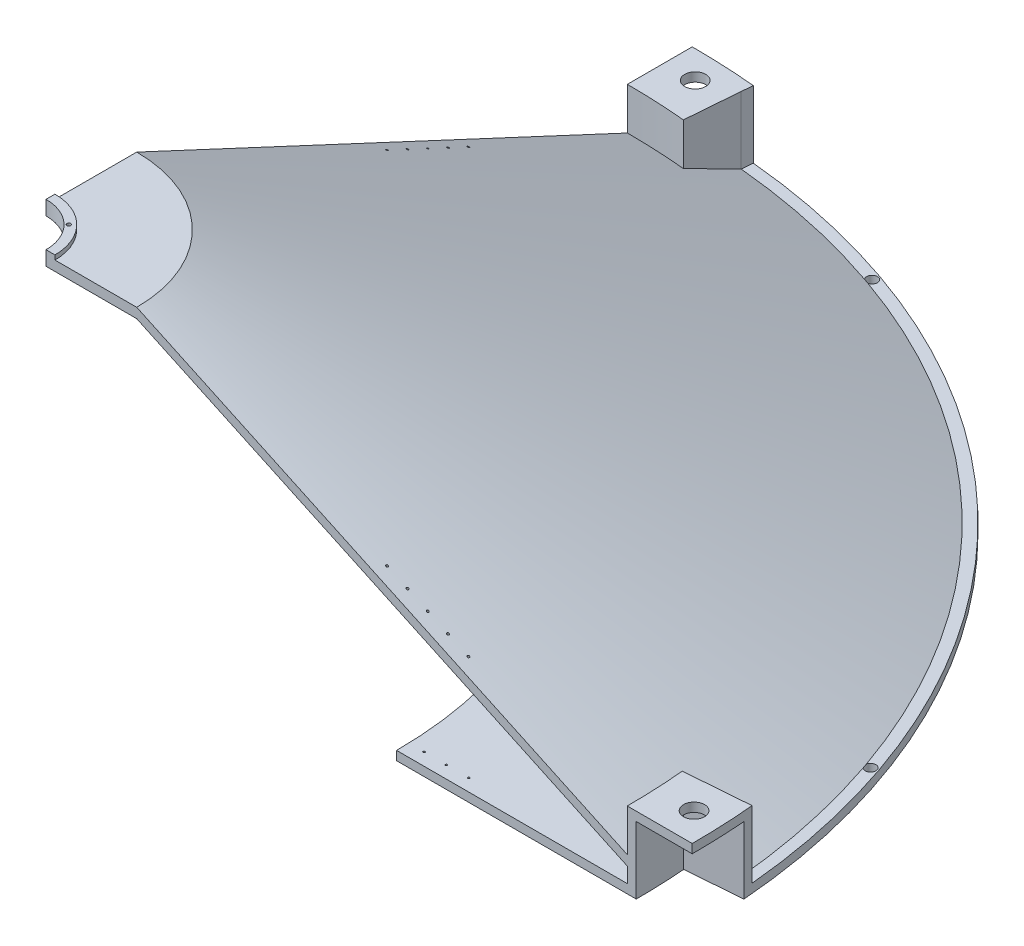
from build123d import *

# Parameters (mm, degrees)
REVOLVE_2_ANGLE            = 90
CUT_EXTRUDE_1_DEPTH        = 2251.376533994
CUT_EXTRUDE_1_DEPTH_BACK   = 2251.376533994
CUT_EXTRUDE_2_DEPTH        = 2246.838580031
EXTRUDE_START              = -20
EXTRUDE_2_DEPTH            = 20
EXTRUDE_3_DEPTH            = 130
EXTRUDE_4_DEPTH            = 130
EXTRUDE_5_DEPTH            = 20
CUT_EXTRUDE_5_DEPTH        = 2251.376534019
CUT_EXTRUDE_5_DEPTH_BACK   = 2251.376534019
EXTRUDE_6_DEPTH            = 150
EXTRUDE_7_DEPTH            = 20
EXTRUDE_START_2            = -22.067558379
EXTRUDE_8_DEPTH            = 22.067558379
EXTRUDE_9_DEPTH            = 10
EXTRUDE_10_DEPTH           = 20
EXTRUDE_11_DEPTH           = 20
CUT_EXTRUDE_12_DEPTH       = 10
HOLE_WIZARD_M5_2_D         = 4.2
HOLE_WIZARD_M5_2_DEPTH     = 20
CUT_EXTRUDE_13_REACH       = 2080.406
SKETCH_35_R                = 2.5
PATTERN_START              = 638.392822278
PATTERN_LINEAR_1_OUTLINE_R = 2.5
PATTERN_LINEAR_1_DEPTH     = 19.869622652
HOLE_WIZARD_M10_1_D        = 8.5
M52X5_0_1_D                = 47
M52X5_0_2_D                = 47
SKETCH_46_W                = 12
SKETCH_46_H                = 20
SKETCH_47_W                = 12
SKETCH_47_H                = 20


# Read off the part's stored shape, not the designer's step: 阵列(线性)1
with BuildPart() as part:
    # 草图1 → 旋转2 (revolve)
    with BuildSketch(Plane.XY):
        Polygon((1540, 0), (1540, 20), (1515, 20), (300, 586.563804658), (280, 586.563804658), (280, 564.496246279), (300, 564.496246279), (1467.675968337, 20), (1390, 20), (1390, 0), align=None)
    revolve(axis=Axis((0, 0, 0), (0, 1, 0)), revolution_arc=REVOLVE_2_ANGLE)

    # 草图2 → 切除-拉伸1 (cut, two sides: drawn at the far end of the back side and taken through both)
    with BuildSketch(Plane(origin=(0, 20, 0), x_dir=(1, 0, 0), z_dir=(0, 1, 0)).offset(-CUT_EXTRUDE_1_DEPTH_BACK)):
        with BuildLine():
            Line((132.87469752, 1408.889390534), (140.845680115, 1508.438760571))
            ThreePointArc((140.845680115, 1508.438760571), (70.499211822, 1513.358801188), (0, 1515))
            Line((0, 1515), (0, 1415))
            Line((0, 1415), (0, 1395.143361809))
            ThreePointArc((0, 1395.143361809), (65.712127421, 1393.594961353), (131.278393577, 1388.953196972))
            Line((131.278393577, 1388.953196972), (132.87469752, 1408.889390534))
        make_face()
        with BuildLine():
            ThreePointArc((0, 1515), (70.499211822, 1513.358801188), (140.845680115, 1508.438760571))
            Line((140.845680115, 1508.438760571), (142.841231116, 1533.361139032))
            ThreePointArc((142.841231116, 1533.361139032), (71.497712868, 1538.339389424), (0, 1540))
            Line((0, 1540), (0, 1515))
        make_face()
    extrude(amount=CUT_EXTRUDE_1_DEPTH + CUT_EXTRUDE_1_DEPTH_BACK, mode=Mode.SUBTRACT)

    # 草图4 → 切除-拉伸2 (cut, through all)
    with BuildSketch(Plane(origin=(0, 20, 0), x_dir=(1, 0, 0), z_dir=(0, 1, 0))):
        Polygon((132.660492111, 1406.214185404), (126.41777594, 1328.249084529), (-62.065824985, 1343.341088647), (0, 1480.500176112), align=None)
    extrude(amount=-CUT_EXTRUDE_2_DEPTH, mode=Mode.SUBTRACT)

    # 草图6 → 凸台-拉伸2 (add)
    with BuildSketch(Plane(origin=(0, 20, 0), x_dir=(1, 0, 0), z_dir=(0, 1, 0)).offset(EXTRUDE_START)):
        with BuildLine():
            Line((131.278393577, 1388.953196972), (142.841231116, 1533.361139032))
            ThreePointArc((142.841231116, 1533.361139032), (132.881119013, 1534.25636978), (122.9154036, 1535.086904236))
            Line((122.9154036, 1535.086904236), (112.938503957, 1410.485694477))
            ThreePointArc((112.938503957, 1410.485694477), (56.514344707, 1413.870973194), (0, 1415))
            Line((0, 1415), (0, 1395.143361809))
            Line((0, 1395.143361809), (0, 1390))
            ThreePointArc((0, 1390), (65.506700902, 1388.455570819), (130.867832796, 1383.825715305))
            Line((130.867832796, 1383.825715305), (131.278393577, 1388.953196972))
        make_face()
    extrude(amount=EXTRUDE_2_DEPTH)

    # 草图7 → 凸台-拉伸3 (add)
    with BuildSketch(Plane(origin=(0, 20, 0), x_dir=(1, 0, 0), z_dir=(0, 1, 0))):
        with BuildLine():
            Line((140.845680115, 1508.438760571), (131.278393577, 1388.953196972))
            ThreePointArc((131.278393577, 1388.953196972), (65.712127421, 1393.594961353), (0, 1395.143361809))
            Line((0, 1395.143361809), (0, 1415))
            ThreePointArc((0, 1415), (56.514344707, 1413.870973194), (112.938503957, 1410.485694477))
            Line((112.938503957, 1410.485694477), (120.920023672, 1510.166662284))
            ThreePointArc((120.920023672, 1510.166662284), (130.88570331, 1509.335593123), (140.845680115, 1508.438760571))
        make_face()
    extrude(amount=EXTRUDE_3_DEPTH)

    # 草图8 → 凸台-拉伸4 (add)
    with BuildSketch(Plane(origin=(0, 20, 0), x_dir=(1, 0, 0), z_dir=(0, 1, 0))):
        with BuildLine():
            Line((140.845680115, 1508.438760571), (143.169866256, 1533.330489293))
            ThreePointArc((143.169866256, 1533.330489293), (133.045533397, 1534.242121063), (122.9154036, 1535.086904236))
            Line((122.9154036, 1535.086904236), (120.920023672, 1510.166662284))
            ThreePointArc((120.920023672, 1510.166662284), (130.88570331, 1509.335593123), (140.845680115, 1508.438760571))
        make_face()
    extrude(amount=EXTRUDE_4_DEPTH)

    # 草图9 → 凸台-拉伸5 (add)
    with BuildSketch(Plane(origin=(0, 150, 0), x_dir=(1, 0, 0), z_dir=(0, 1, 0))):
        with BuildLine():
            Line((0, 1415), (0, 1540))
            ThreePointArc((0, 1540), (61.506777985, 1538.771235844), (122.915403601, 1535.086904236))
            ThreePointArc((122.915403601, 1535.086904236), (133.045533398, 1534.242121062), (143.169866256, 1533.330489293))
            Line((143.169866256, 1533.330489293), (140.845680115, 1508.438760571))
            Line((140.845680115, 1508.438760571), (131.278393577, 1388.953196972))
            ThreePointArc((131.278393577, 1388.953196972), (65.712127421, 1393.594961353), (0, 1395.143361809))
            Line((0, 1395.143361809), (0, 1415))
        make_face()
    extrude(amount=EXTRUDE_5_DEPTH)

    # 草图12 → 切除-拉伸5 (cut, two sides: drawn at the far end of the back side and taken through both)
    with BuildSketch(Plane(origin=(0, 20, 0), x_dir=(1, 0, 0), z_dir=(0, 1, 0)).offset(-CUT_EXTRUDE_5_DEPTH_BACK)):
        with BuildLine():
            Line((1533.620824365, 140.025594352), (1389.048955363, 128.71674174))
            ThreePointArc((1389.048955363, 128.71674174), (1393.511444648, 64.427118779), (1395, 0))
            Line((1395, 0), (1515, 0))
            Line((1515, 0), (1535, 0))
            Line((1535, 0), (1540, 0))
            ThreePointArc((1540, 0), (1538.404379466, 70.085413881), (1533.620824365, 140.025594352))
        make_face()
    extrude(amount=CUT_EXTRUDE_5_DEPTH + CUT_EXTRUDE_5_DEPTH_BACK, mode=Mode.SUBTRACT)

    # 草图13 → 凸台-拉伸6 (add)
    with BuildSketch(Plane.XZ):
        with BuildLine():
            Line((1535.310000958, -120.096631757), (1410.6906827, -110.34852853))
            ThreePointArc((1410.6906827, -110.34852853), (1413.922260244, -55.21631997), (1415.000000001, 0))
            Line((1415.000000001, 0), (1395, 0))
            ThreePointArc((1395, 0), (1393.511444648, -64.427118779), (1389.048955363, -128.71674174))
            Line((1389.048955363, -128.71674174), (1533.620824365, -140.025594352))
            ThreePointArc((1533.620824365, -140.025594352), (1534.497765897, -130.063855311), (1535.310000958, -120.096631757))
        make_face()
    extrude(amount=-EXTRUDE_6_DEPTH)

    # 草图14 → 凸台-拉伸7 (add)
    with BuildSketch(Plane(origin=(0, 150, 0), x_dir=(1, 0, 0), z_dir=(0, 1, 0))):
        with BuildLine():
            Line((1395, 0), (1415.000000001, 0))
            Line((1415.000000001, 0), (1540, 0))
            ThreePointArc((1540, 0), (1538.404379466, 70.085413881), (1533.620824365, 140.025594352))
            Line((1533.620824365, 140.025594352), (1389.048955363, 128.71674174))
            ThreePointArc((1389.048955363, 128.71674174), (1393.511444648, 64.427118779), (1395, 0))
        make_face()
    extrude(amount=EXTRUDE_7_DEPTH)

    # 草图18 → 凸台-拉伸8 (add)
    with BuildSketch(Plane(origin=(0, 586.563804658, 0), x_dir=(1, 0, 0), z_dir=(0, 1, 0)).offset(EXTRUDE_START_2)):
        with BuildLine():
            Line((0, 97.5), (0, 280))
            ThreePointArc((0, 280), (197.989898732, 197.989898732), (280, 0))
            Line((280, 0), (97.5, 0))
            ThreePointArc((97.5, 0), (68.942911166, 68.942911166), (0, 97.5))
        make_face()
    extrude(amount=EXTRUDE_8_DEPTH)

    # 草图19 → 凸台-拉伸9 (add)
    with BuildSketch(Plane(origin=(0, 586.563804658, 0), x_dir=(1, 0, 0), z_dir=(0, 1, 0))):
        with BuildLine():
            Line((0, 97.5), (0, 117.5))
            ThreePointArc((0, 117.5), (83.085046789, 83.085046789), (117.5, 0))
            Line((117.5, 0), (97.5, 0))
            ThreePointArc((97.5, 0), (68.942911166, 68.942911166), (0, 97.5))
        make_face()
    extrude(amount=EXTRUDE_9_DEPTH)

    # 草图25 → 凸台-拉伸10 (add)
    with BuildSketch(Plane.XZ):
        with BuildLine():
            Line((0, -1390), (0, -1159.93299612))
            ThreePointArc((0, -1159.93299612), (820.196487278, -820.196487278), (1159.93299612, 0))
            Line((1159.93299612, 0), (1390, 0))
            ThreePointArc((1390, 0), (982.878425849, -982.878425849), (0, -1390))
        make_face()
    extrude(amount=-EXTRUDE_10_DEPTH)

    # 草图26 → 凸台-拉伸11 (add)
    with BuildSketch(Plane.XZ):
        with BuildLine():
            Line((1159.93299612, 0), (880, 0))
            ThreePointArc((880, 0), (622.253967444, -622.253967444), (0, -880))
            Line((0, -880), (0, -1159.93299612))
            ThreePointArc((0, -1159.93299612), (820.196487278, -820.196487278), (1159.93299612, 0))
        make_face()
    extrude(amount=-EXTRUDE_11_DEPTH)

    # 草图31 → 切除-拉伸12 (cut)
    with BuildSketch(Plane.XZ):
        Polygon((777.891363409, -848.602041527), (765.163441347, -835.874119466), (772.234509159, -828.803051654), (797.690353282, -854.258895777), (790.61928547, -861.329963589), align=None)
        Polygon((848.599888981, -777.889210862), (861.327811042, -790.617132923), (854.25674323, -797.688200735), (828.800899108, -772.232356613), (835.871966919, -765.161288801), align=None)
    extrude(amount=-CUT_EXTRUDE_12_DEPTH, mode=Mode.SUBTRACT)

    # M5 螺纹孔2
    with Locations(Plane(origin=(27.5, 20, -913.77), x_dir=(1, 0, 0), z_dir=(0, 1, 0))):
        with Locations((0, 0), (0, 50), (0, 100)):
            hole_wizard_m5_2 = Hole(HOLE_WIZARD_M5_2_D / 2, depth=HOLE_WIZARD_M5_2_DEPTH)

    # 镜向1: M5 螺纹孔2 across plane
    add(hole_wizard_m5_2.mirror(Plane(origin=(0, 0, 0), x_dir=(-0.7071067811865464, -5.422796936895889e-15, 0.7071067811865487), z_dir=(-0.7071067811865489, -5.42279693689591e-15, -0.7071067811865462))), mode=Mode.SUBTRACT)

    # 切除-拉伸13: up to this cone (the profile starts inside it)
    cut_extrude_13_end = Plane(origin=(0, 320.550907, 0), z_dir=(0, -1, 0)).offset(-405.905194105) * Cone(2.145e-06, 7199.705251167, 3357.277694078, align=(Align.CENTER, Align.CENTER, Align.MIN), mode=Mode.PRIVATE)
    # 草图35 → 切除-拉伸13 (cut, up to the surface)
    with BuildSketch(Plane(origin=(269.796464859, 578.580386019, 0), x_dir=(-0.9063077870366527, 0.4226182617406935, -1.286470576795655e-15), z_dir=(0.4226182617406935, 0.9063077870366527, 0)), mode=Mode.PRIVATE) as cut_extrude_13_sk1:
        with Locations(Location((-610.549760586, -27.5, 0), (0, 0, 180))):
            Circle(SKETCH_35_R)
    cut_extrude_13_tool1 = extrude(cut_extrude_13_sk1.sketch, amount=CUT_EXTRUDE_13_REACH, mode=Mode.PRIVATE) & cut_extrude_13_end
    cut_extrude_13 = cut_extrude_13_tool1.solids().sort_by_distance((823.142467, 320.550907, -27.5))[0]
    add(cut_extrude_13, mode=Mode.SUBTRACT)

    # 阵列(线性)1 outline → 阵列(线性)1 (cut)
    with BuildSketch(Plane(origin=(0, 0, 0), x_dir=(0.9063077870366526, -0.42261826174069383, 0), z_dir=(0.42261826174069383, 0.9063077870366526, 0)).offset(PATTERN_START)):
        with Locations((810.549760586, 27.5)):
            Circle(PATTERN_LINEAR_1_OUTLINE_R)
        with Locations((760.549760586, 27.5)):
            Circle(PATTERN_LINEAR_1_OUTLINE_R)
        with Locations((710.549760586, 27.5)):
            Circle(PATTERN_LINEAR_1_OUTLINE_R)
        with Locations((660.549760586, 27.5)):
            Circle(PATTERN_LINEAR_1_OUTLINE_R)
    pattern_linear_1 = extrude(amount=PATTERN_LINEAR_1_DEPTH, mode=Mode.SUBTRACT)

    # 镜向2: 切除-拉伸13, 阵列(线性)1 across plane
    add(cut_extrude_13.mirror(Plane(origin=(0, 0, 0), x_dir=(-0.7071067811865464, -5.422796936895889e-15, 0.7071067811865487), z_dir=(-0.7071067811865489, -5.42279693689591e-15, -0.7071067811865462))), mode=Mode.SUBTRACT)
    add(pattern_linear_1.mirror(Plane(origin=(0, 0, 0), x_dir=(-0.7071067811865464, -5.422796936895889e-15, 0.7071067811865487), z_dir=(-0.7071067811865489, -5.42279693689591e-15, -0.7071067811865462))), mode=Mode.SUBTRACT)

    # M10 螺纹孔1 (through all)
    with Locations(Plane(origin=(74.246212025, 596.563804658, -74.246212025), x_dir=(1, 0, 0), z_dir=(0, 1, 0))):
        with Locations((0, 0)):
            Hole(HOLE_WIZARD_M10_1_D / 2)

    # M52x5.0 螺纹孔1 (through all)
    with Locations(Plane(origin=(1478.549706668, 170, -65.503930537), x_dir=(0, 0, 1), z_dir=(0, 1, 0))):
        with Locations((0, 0)):
            Hole(M52X5_0_1_D / 2)

    # M52x5.0 螺纹孔2 (through all)
    with Locations(Plane(origin=(68.218577138, 170, -1478.426942981), x_dir=(0, 0, 1), z_dir=(0, 1, 0))):
        with Locations((0, 0)):
            Hole(M52X5_0_2_D / 2)

    # 草图46 → M27 螺纹孔1 (revolve, cut)
    with BuildSketch(Plane(origin=(1442.493857707, 20, -495.440683107), x_dir=(0, 0, 1), z_dir=(1, 0, 0))):
        with Locations((6, 10)):
            Rectangle(SKETCH_46_W, SKETCH_46_H)
    revolve(axis=Axis((1442.493857707, 26.35, -495.440683107), (0, -1, 0)), mode=Mode.SUBTRACT)

    # 草图47 → M27 螺纹孔2 (revolve, cut)
    with BuildSketch(Plane(origin=(500.734443817, 20, -1440.664782929), x_dir=(0, 0, 1), z_dir=(1, 0, 0))):
        with Locations((6, 10)):
            Rectangle(SKETCH_47_W, SKETCH_47_H)
    revolve(axis=Axis((500.734443817, 26.35, -1440.664782929), (0, -1, 0)), mode=Mode.SUBTRACT)


solid = part.part
